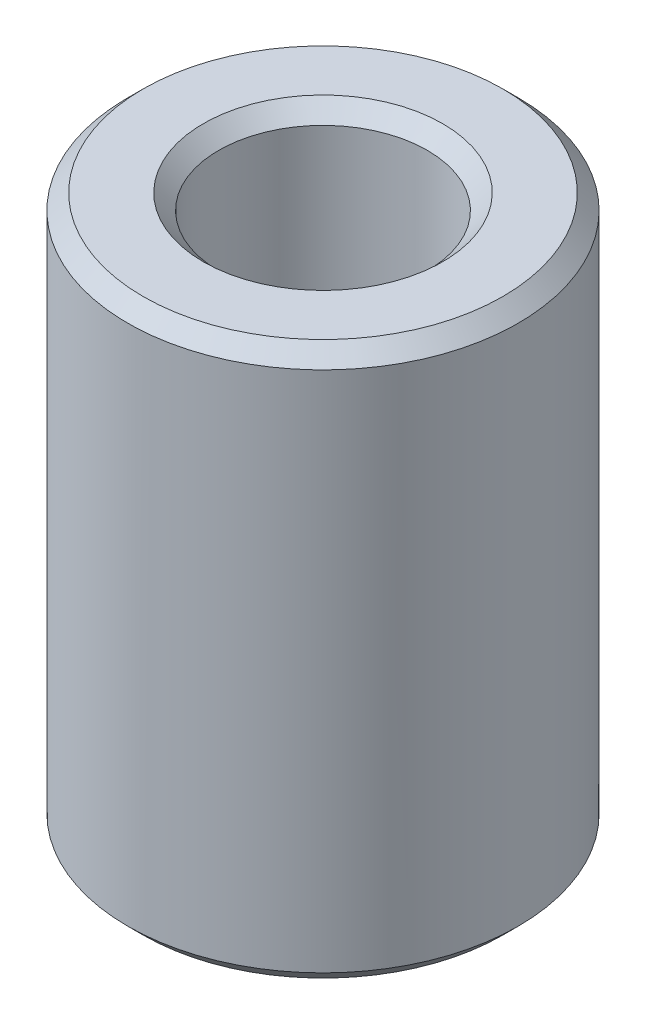
from build123d import *

# Parameters (mm, degrees)
SKETCH1_R           = 45
BOSS_EXTRUDE1_DEPTH = 127.457256159
SKETCH2_R           = 24.036574145
CUT_EXTRUDE1_DEPTH  = 143.46175679
CHAMFER1_SIZE       = 3.548965045


with BuildPart() as part:
    # Sketch1 → Boss-Extrude1 (new body)
    with BuildSketch(Plane(origin=(0, 0, 0), x_dir=(1, 0, 0), z_dir=(0, 1, 0))):
        Circle(SKETCH1_R)
    extrude(amount=BOSS_EXTRUDE1_DEPTH)

    # Sketch2 → Cut-Extrude1 (cut, through all)
    with BuildSketch(Plane(origin=(0, 0, 0), x_dir=(1, 0, 0), z_dir=(0, 1, 0))):
        Circle(SKETCH2_R)
    extrude(amount=CUT_EXTRUDE1_DEPTH, mode=Mode.SUBTRACT)

    # Chamfer1
    chamfer1_edges = [part.edges().sort_by_distance(p)[0] for p in [
        (-24.036574145, 127.457256159, 0),
        (-24.036574145, 0, 0),
        (-45, 0, 0),
        (-45, 127.457256159, 0),
    ]]
    chamfer(chamfer1_edges, length=CHAMFER1_SIZE)


solid = part.part
